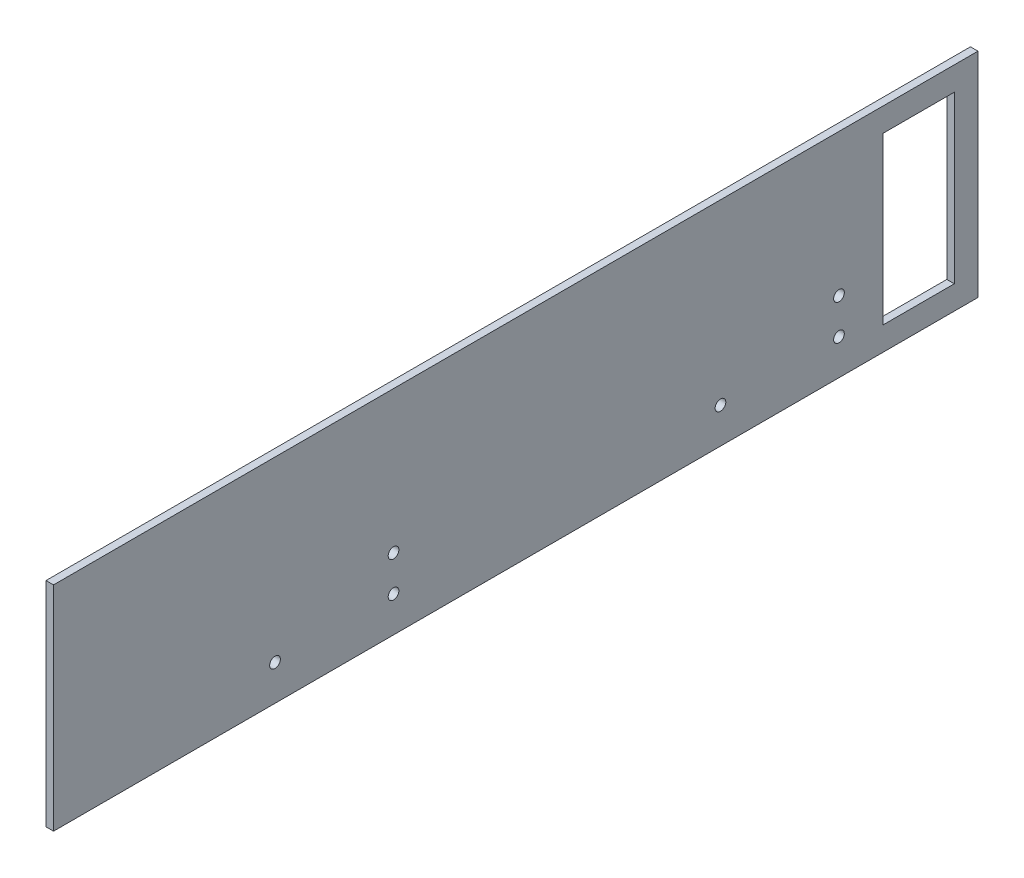
from build123d import *

# Parameters (mm, degrees)
SKETCH1_W                = 390
SKETCH1_H                = 90
BOSS_EXTRUDE1_DEPTH      = 3.175
M4_CLEARANCE_HOLE1_D     = 4.5
M4_CLEARANCE_HOLE1_DEPTH = 10.1
M4_CLEARANCE_HOLE1_TIP   = 1.351936393
SKETCH4_W                = 30
SKETCH4_H                = 70
CUT_EXTRUDE1_DEPTH       = 201.150145204


with BuildPart() as part:
    # Sketch1 → Boss-Extrude1 (new body)
    with BuildSketch(Plane(origin=(0, 0, 0), x_dir=(0, 0, -1), z_dir=(1, 0, 0))):
        Rectangle(SKETCH1_W, SKETCH1_H)
    extrude(amount=BOSS_EXTRUDE1_DEPTH)

    # M4 Clearance Hole1
    with Locations(Plane(origin=(3.175, 0, 0), x_dir=(0, 0, -1), z_dir=(1, 0, 0))):
        with Locations((136.351636823, -15), (-101.563539669, -30), (-51.563539669, -30), (-51.563539669, -15), (86.351636823, -30), (136.351636823, -30)):
            Hole(M4_CLEARANCE_HOLE1_D / 2, depth=M4_CLEARANCE_HOLE1_DEPTH)
            with Locations((0, 0, -(M4_CLEARANCE_HOLE1_DEPTH + M4_CLEARANCE_HOLE1_TIP / 2))):  # 118° drill point
                Cone(0, M4_CLEARANCE_HOLE1_D / 2, M4_CLEARANCE_HOLE1_TIP, mode=Mode.SUBTRACT)

    # Sketch4 → Cut-Extrude1 (cut, through all)
    with BuildSketch(Plane(origin=(3.175, 0, 0), x_dir=(0, 0, -1), z_dir=(1, 0, 0))):
        with Locations((170, 0)):
            Rectangle(SKETCH4_W, SKETCH4_H)
    extrude(amount=-CUT_EXTRUDE1_DEPTH, mode=Mode.SUBTRACT)


solid = part.part
